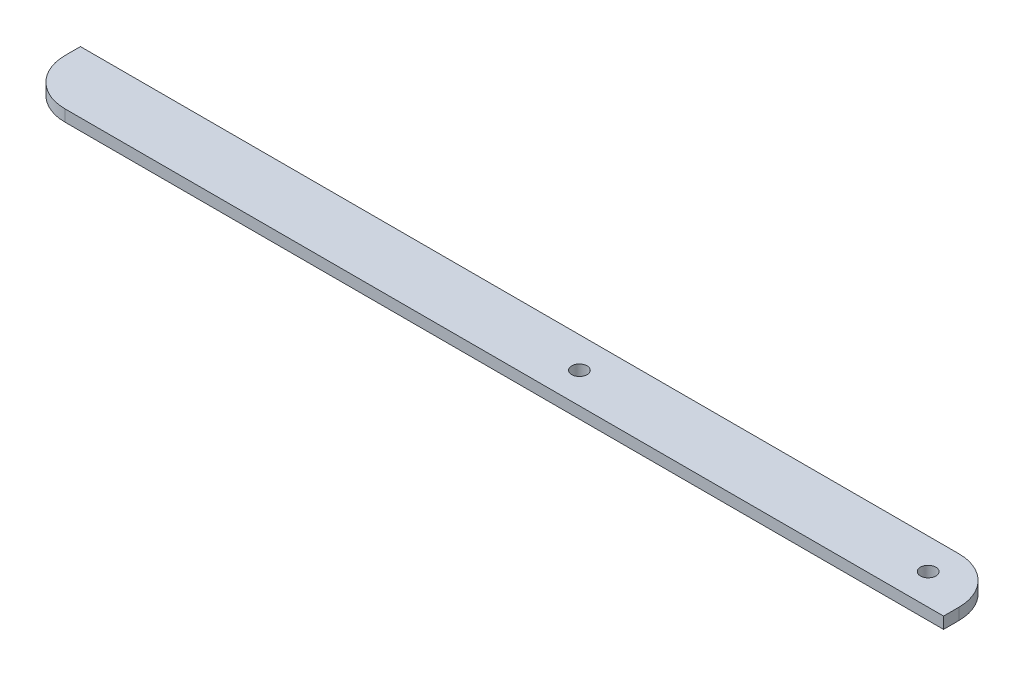
from build123d import *

# Parameters (mm, degrees)
SKETCH1_R           = 12.7
BOSS_EXTRUDE1_DEPTH = 19.05


with BuildPart() as part:
    # Sketch1 → Boss-Extrude1 (new body)
    with BuildSketch(Plane(origin=(0, 0, 0), x_dir=(1, 0, 0), z_dir=(0, 1, 0))):
        with BuildLine():
            Line((-685.8, -50.8), (762, -50.8))
            Line((762, -50.8), (762, -25.4))
            ThreePointArc((762, -25.4), (739.681536726, 28.481536726), (685.8, 50.8))
            Line((685.8, 50.8), (-762, 50.8))
            Line((-762, 50.8), (-762, 25.4))
            ThreePointArc((-762, 25.4), (-739.681536726, -28.481536726), (-685.8, -50.8))
        make_face()
        with Locations((111.06, 0)):
            Circle(SKETCH1_R, mode=Mode.SUBTRACT)
        with Locations((685.8, 0)):
            Circle(SKETCH1_R, mode=Mode.SUBTRACT)
    extrude(amount=BOSS_EXTRUDE1_DEPTH)


solid = part.part
